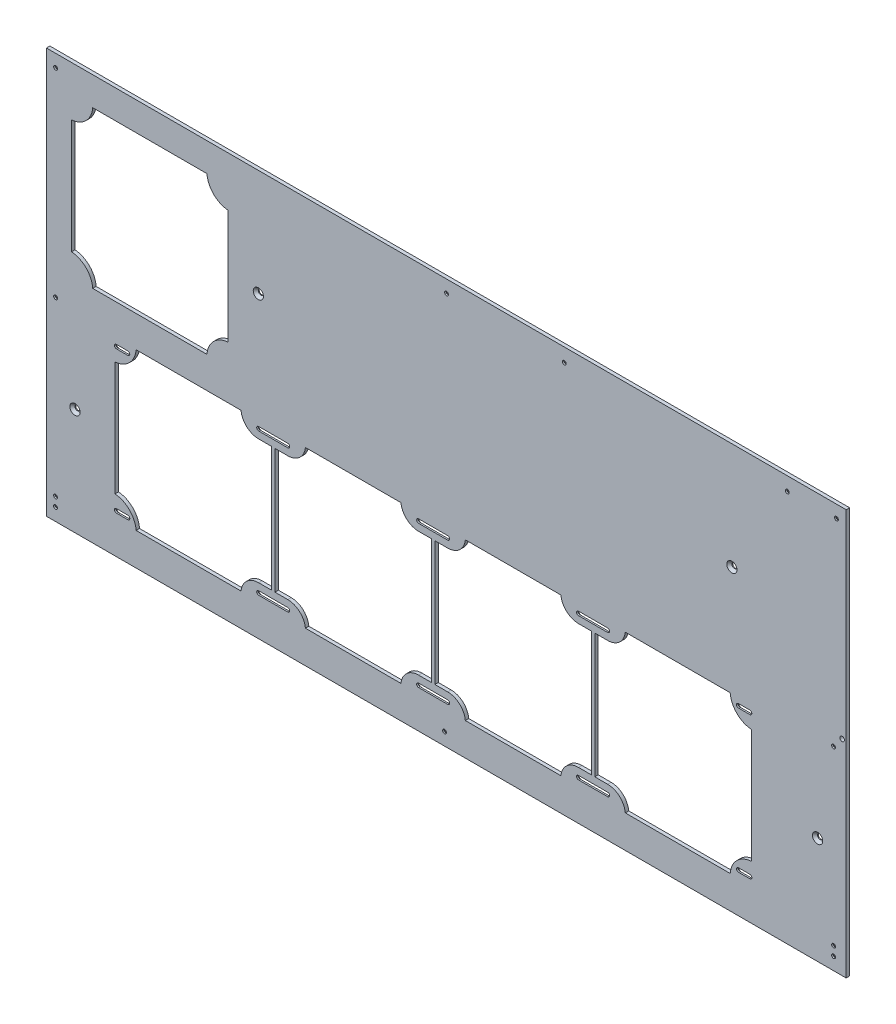
from build123d import *

# Parameters (mm, degrees)
SKETCH1_R                     = 2
BASE_FLANGE1_DEPTH            = 3
CSK_FOR_M4_SFHCS1_AT_2_COUNT  = 2
CSK_FOR_M4_SFHCS1_AT_2_PITCH  = 232.345109697
CSK_FOR_M4_SFHCS1_AT_3_COUNT  = 2
CSK_FOR_M4_SFHCS1_AT_3_PITCH  = 414.5
CSK_FOR_M4_SFHCS1_AT_4_COUNT  = 2
CSK_FOR_M4_SFHCS1_AT_4_PITCH  = 517.527052433
CSK_FOR_M3_SFHCS1_AT_2_COUNT  = 2
CSK_FOR_M3_SFHCS1_AT_2_PITCH  = 43.010492906
CSK_FOR_M3_SFHCS1_AT_3_COUNT  = 2
CSK_FOR_M3_SFHCS1_AT_3_PITCH  = 325.009615242
CSK_FOR_M3_SFHCS1_AT_4_COUNT  = 2
CSK_FOR_M3_SFHCS1_AT_4_PITCH  = 333.009384252
CSK_FOR_M3_SFHCS1_AT_5_COUNT  = 2
CSK_FOR_M3_SFHCS1_AT_5_PITCH  = 478.056482019
CSK_FOR_M3_SFHCS1_AT_6_COUNT  = 2
CSK_FOR_M3_SFHCS1_AT_6_PITCH  = 760.30339339
CSK_FOR_M3_SFHCS1_AT_7_COUNT  = 2
CSK_FOR_M3_SFHCS1_AT_7_PITCH  = 756.83370036
CSK_FOR_M3_SFHCS1_AT_8_COUNT  = 2
CSK_FOR_M3_SFHCS1_AT_8_PITCH  = 705.300113427
CSK_FOR_M3_SFHCS1_AT_9_COUNT  = 2
CSK_FOR_M3_SFHCS1_AT_9_PITCH  = 683.5
CSK_FOR_M3_SFHCS1_AT_10_COUNT = 2
CSK_FOR_M3_SFHCS1_AT_10_PITCH = 341.25
CSK_FOR_M3_SFHCS1_AT_11_COUNT = 2
CSK_FOR_M3_SFHCS1_AT_11_PITCH = 238.201894409
CSK_FOR_M3_SFHCS1_AT_12_COUNT = 2
CSK_FOR_M3_SFHCS1_AT_12_PITCH = 174.017958843
CUT_EXTRUDE1_DEPTH            = 784.07726311
CHAMFER1_SIZE                 = 1.66


# Read off the part's stored shape, not the designer's step: bottom.step
# Sheet-metal steps are written as plain solids
with BuildPart() as part:
    # Base-Flange1: sheet metal written as solids
    # Sketch1 → Base-Flange1 (new body)
    with BuildSketch(Plane.XY):
        Polygon((0, 351), (0, 347), (0, 0), (0, -4), (700, -4), (700, 0), (700, 347), (700, 351), align=None)
        with Locations((696.5, 175.5)):
            Circle(SKETCH1_R, mode=Mode.SUBTRACT)
        with BuildLine():
            Line((548.5, 24.5), (598.5, 24.5))
            ThreePointArc((598.5, 24.5), (604.318145396, 37.181854604), (617, 43))
            Line((617, 43), (617, 143))
            ThreePointArc((617, 143), (604.318145396, 148.818145396), (598.5, 161.5))
            Line((598.5, 161.5), (548.5, 161.5))
            Line((548.5, 161.5), (506.67724862, 161.5))
            ThreePointArc((506.67724862, 161.5), (501.666333328, 151.521759717), (491.25, 147.5))
            Line((491.25, 147.5), (480, 147.5))
            Line((480, 147.5), (480, 93))
            Line((480, 93), (480, 38.5))
            Line((480, 38.5), (491.25, 38.5))
            ThreePointArc((491.25, 38.5), (501.666333328, 34.478240283), (506.67724862, 24.5))
            Line((506.67724862, 24.5), (548.5, 24.5))
        make_face(mode=Mode.SUBTRACT)
        with BuildLine():
            Line((477, 147.5), (465.75, 147.5))
            ThreePointArc((465.75, 147.5), (455.333666672, 151.521759717), (450.32275138, 161.5))
            Line((450.32275138, 161.5), (408.5, 161.5))
            Line((408.5, 161.5), (366.67724862, 161.5))
            ThreePointArc((366.67724862, 161.5), (361.666333328, 151.521759717), (351.25, 147.5))
            Line((351.25, 147.5), (340, 147.5))
            Line((340, 147.5), (340, 93))
            Line((340, 93), (340, 38.5))
            Line((340, 38.5), (351.25, 38.5))
            ThreePointArc((351.25, 38.5), (361.666333328, 34.478240283), (366.67724862, 24.5))
            Line((366.67724862, 24.5), (408.5, 24.5))
            Line((408.5, 24.5), (450.32275138, 24.5))
            ThreePointArc((450.32275138, 24.5), (455.333666672, 34.478240283), (465.75, 38.5))
            Line((465.75, 38.5), (477, 38.5))
            Line((477, 38.5), (477, 93))
            Line((477, 93), (477, 147.5))
        make_face(mode=Mode.SUBTRACT)
        with BuildLine():
            Line((337, 147.5), (325.75, 147.5))
            ThreePointArc((325.75, 147.5), (315.333666672, 151.521759717), (310.32275138, 161.5))
            Line((310.32275138, 161.5), (268.5, 161.5))
            Line((268.5, 161.5), (226.67724862, 161.5))
            ThreePointArc((226.67724862, 161.5), (221.666333328, 151.521759717), (211.25, 147.5))
            Line((211.25, 147.5), (200, 147.5))
            Line((200, 147.5), (200, 93))
            Line((200, 93), (200, 38.5))
            Line((200, 38.5), (211.25, 38.5))
            ThreePointArc((211.25, 38.5), (221.666333328, 34.478240283), (226.677248621, 24.5))
            Line((226.677248621, 24.5), (268.5, 24.5))
            Line((268.5, 24.5), (310.32275138, 24.5))
            ThreePointArc((310.32275138, 24.5), (315.333666672, 34.478240283), (325.75, 38.5))
            Line((325.75, 38.5), (337, 38.5))
            Line((337, 38.5), (337, 93))
            Line((337, 93), (337, 147.5))
        make_face(mode=Mode.SUBTRACT)
        with BuildLine():
            Line((197, 147.5), (185.75, 147.5))
            ThreePointArc((185.75, 147.5), (175.333666672, 151.521759717), (170.322751379, 161.5))
            Line((170.322751379, 161.5), (128.5, 161.5))
            Line((128.5, 161.5), (78.5, 161.5))
            ThreePointArc((78.5, 161.5), (72.681854604, 148.818145396), (60, 143))
            Line((60, 143), (60, 43))
            ThreePointArc((60, 43), (72.681854604, 37.181854604), (78.5, 24.5))
            Line((78.5, 24.5), (128.5, 24.5))
            Line((128.5, 24.5), (170.32275138, 24.5))
            ThreePointArc((170.32275138, 24.5), (175.333666672, 34.478240283), (185.75, 38.5))
            Line((185.75, 38.5), (197, 38.5))
            Line((197, 38.5), (197, 93))
            Line((197, 93), (197, 147.5))
        make_face(mode=Mode.SUBTRACT)
        with BuildLine():
            Line((90.5, 326), (40.5, 326))
            ThreePointArc((40.5, 326), (34.681854604, 313.318145396), (22, 307.5))
            Line((22, 307.5), (22, 257.5))
            Line((22, 257.5), (22, 207.5))
            ThreePointArc((22, 207.5), (34.681854604, 201.681854604), (40.5, 189))
            Line((40.5, 189), (90.5, 189))
            Line((90.5, 189), (140.5, 189))
            ThreePointArc((140.5, 189), (146.318145396, 201.681854604), (159, 207.5))
            Line((159, 207.5), (159, 257.5))
            Line((159, 257.5), (159, 307.5))
            ThreePointArc((159, 307.5), (146.318145396, 313.318145396), (140.5, 326))
            Line((140.5, 326), (90.5, 326))
        make_face(mode=Mode.SUBTRACT)
    extrude(amount=-BASE_FLANGE1_DEPTH)

    # Sketch3 → CSK for M4 SFHCS1 (revolve, cut)
    with BuildSketch(Plane(origin=(185.5, 257.5, 0), x_dir=(0, -1, 0), z_dir=(1, 0, 0))):
        Polygon((0, 0), (0, 3), (2.25, 3), (2.25, 2.23), (4.48, 0), align=None)
    csk_for_m4_sfhcs1 = revolve(axis=Axis((185.5, 257.5, 6.35), (0, 0, -1)), mode=Mode.SUBTRACT)

    # CSK for M4 SFHCS1 at 2: CSK for M4 SFHCS1 ×2
    with Locations(*[Vector(-0.690782776575208, -0.7230623455740495, 0) * (i * CSK_FOR_M4_SFHCS1_AT_2_PITCH) for i in range(1, CSK_FOR_M4_SFHCS1_AT_2_COUNT)]):
        add(csk_for_m4_sfhcs1, mode=Mode.SUBTRACT)

    # CSK for M4 SFHCS1 at 3: CSK for M4 SFHCS1 ×2
    with Locations(*[(i * CSK_FOR_M4_SFHCS1_AT_3_PITCH, 0, 0) for i in range(1, CSK_FOR_M4_SFHCS1_AT_3_COUNT)]):
        add(csk_for_m4_sfhcs1, mode=Mode.SUBTRACT)

    # CSK for M4 SFHCS1 at 4: CSK for M4 SFHCS1 ×2
    with Locations(*[Vector(0.9458442755769982, -0.3246207115361302, 0) * (i * CSK_FOR_M4_SFHCS1_AT_4_PITCH) for i in range(1, CSK_FOR_M4_SFHCS1_AT_4_COUNT)]):
        add(csk_for_m4_sfhcs1, mode=Mode.SUBTRACT)

    # Sketch5 → CSK for M3 SFHCS1 (revolve, cut)
    with BuildSketch(Plane(origin=(691.5, 340, -3), x_dir=(0, 1, 0), z_dir=(1, 0, 0))):
        Polygon((0, 0), (0, 3), (1.7, 3), (1.7, 1.66), (3.36, 0), align=None)
    csk_for_m3_sfhcs1 = revolve(axis=Axis((691.5, 340, -9.35), (0, 0, 1)), mode=Mode.SUBTRACT)

    # CSK for M3 SFHCS1 at 2: CSK for M3 SFHCS1 ×2
    with Locations(*[Vector(-0.9997560384666023, -0.0220876334079881, 0) * (i * CSK_FOR_M3_SFHCS1_AT_2_PITCH) for i in range(1, CSK_FOR_M3_SFHCS1_AT_2_COUNT)]):
        add(csk_for_m3_sfhcs1, mode=Mode.SUBTRACT)

    # CSK for M3 SFHCS1 at 3: CSK for M3 SFHCS1 ×2
    with Locations(*[Vector(-0.00769208011933921, -0.9999704155140979, 0) * (i * CSK_FOR_M3_SFHCS1_AT_3_PITCH) for i in range(1, CSK_FOR_M3_SFHCS1_AT_3_COUNT)]):
        add(csk_for_m3_sfhcs1, mode=Mode.SUBTRACT)

    # CSK for M3 SFHCS1 at 4: CSK for M3 SFHCS1 ×2
    with Locations(*[Vector(-0.0075072959448704, -0.9999718198567379, 0) * (i * CSK_FOR_M3_SFHCS1_AT_4_PITCH) for i in range(1, CSK_FOR_M3_SFHCS1_AT_4_COUNT)]):
        add(csk_for_m3_sfhcs1, mode=Mode.SUBTRACT)

    # CSK for M3 SFHCS1 at 5: CSK for M3 SFHCS1 ×2
    with Locations(*[Vector(-0.7174884410136596, -0.6965704106634076, 0) * (i * CSK_FOR_M3_SFHCS1_AT_5_PITCH) for i in range(1, CSK_FOR_M3_SFHCS1_AT_5_COUNT)]):
        add(csk_for_m3_sfhcs1, mode=Mode.SUBTRACT)

    # CSK for M3 SFHCS1 at 6: CSK for M3 SFHCS1 ×2
    with Locations(*[Vector(-0.8989832295140143, -0.437983051101927, 0) * (i * CSK_FOR_M3_SFHCS1_AT_6_PITCH) for i in range(1, CSK_FOR_M3_SFHCS1_AT_6_COUNT)]):
        add(csk_for_m3_sfhcs1, mode=Mode.SUBTRACT)

    # CSK for M3 SFHCS1 at 7: CSK for M3 SFHCS1 ×2
    with Locations(*[Vector(-0.9031046049815783, -0.42942062416827104, 0) * (i * CSK_FOR_M3_SFHCS1_AT_7_PITCH) for i in range(1, CSK_FOR_M3_SFHCS1_AT_7_COUNT)]):
        add(csk_for_m3_sfhcs1, mode=Mode.SUBTRACT)

    # CSK for M3 SFHCS1 at 8: CSK for M3 SFHCS1 ×2
    with Locations(*[Vector(-0.9690910110293626, -0.2467034907375412, 0) * (i * CSK_FOR_M3_SFHCS1_AT_8_PITCH) for i in range(1, CSK_FOR_M3_SFHCS1_AT_8_COUNT)]):
        add(csk_for_m3_sfhcs1, mode=Mode.SUBTRACT)

    # CSK for M3 SFHCS1 at 9: CSK for M3 SFHCS1 ×2
    with Locations(*[(-i * CSK_FOR_M3_SFHCS1_AT_9_PITCH, 0, 0) for i in range(1, CSK_FOR_M3_SFHCS1_AT_9_COUNT)]):
        add(csk_for_m3_sfhcs1, mode=Mode.SUBTRACT)

    # CSK for M3 SFHCS1 at 10: CSK for M3 SFHCS1 ×2
    with Locations(*[(-i * CSK_FOR_M3_SFHCS1_AT_10_PITCH, 0, 0) for i in range(1, CSK_FOR_M3_SFHCS1_AT_10_COUNT)]):
        add(csk_for_m3_sfhcs1, mode=Mode.SUBTRACT)

    # CSK for M3 SFHCS1 at 11: CSK for M3 SFHCS1 ×2
    with Locations(*[Vector(-0.9999920470450988, -0.003988213453791425, 0) * (i * CSK_FOR_M3_SFHCS1_AT_11_PITCH) for i in range(1, CSK_FOR_M3_SFHCS1_AT_11_COUNT)]):
        add(csk_for_m3_sfhcs1, mode=Mode.SUBTRACT)

    # CSK for M3 SFHCS1 at 12: CSK for M3 SFHCS1 ×2
    with Locations(*[Vector(-0.014366333317647544, -0.9998967989082705, 0) * (i * CSK_FOR_M3_SFHCS1_AT_12_PITCH) for i in range(1, CSK_FOR_M3_SFHCS1_AT_12_COUNT)]):
        add(csk_for_m3_sfhcs1, mode=Mode.SUBTRACT)

    # Sketch6 → Cut-Extrude1 (cut, through all)
    with BuildSketch(Plane.XY):
        with BuildLine():
            Line((61.25, 156.95), (71.25, 156.95))
            ThreePointArc((71.25, 156.95), (72.95, 155.25), (71.25, 153.55))
            Line((71.25, 153.55), (61.25, 153.55))
            ThreePointArc((61.25, 153.55), (59.55, 155.25), (61.25, 156.95))
        make_face()
        with BuildLine():
            Line((185.75, 156.95), (211.25, 156.95))
            ThreePointArc((211.25, 156.95), (212.95, 155.25), (211.25, 153.55))
            Line((211.25, 153.55), (185.75, 153.55))
            ThreePointArc((185.75, 153.55), (184.05, 155.25), (185.75, 156.95))
        make_face()
        with BuildLine():
            Line((61.25, 32.45), (71.25, 32.45))
            ThreePointArc((71.25, 32.45), (72.95, 30.75), (71.25, 29.05))
            Line((71.25, 29.05), (61.25, 29.05))
            ThreePointArc((61.25, 29.05), (59.55, 30.75), (61.25, 32.45))
        make_face()
        with BuildLine():
            Line((185.75, 32.45), (211.25, 32.45))
            ThreePointArc((211.25, 32.45), (212.95, 30.75), (211.25, 29.05))
            Line((211.25, 29.05), (185.75, 29.05))
            ThreePointArc((185.75, 29.05), (184.05, 30.75), (185.75, 32.45))
        make_face()
        with BuildLine():
            Line((325.75, 156.95), (351.25, 156.95))
            ThreePointArc((351.25, 156.95), (352.95, 155.25), (351.25, 153.55))
            Line((351.25, 153.55), (325.75, 153.55))
            ThreePointArc((325.75, 153.55), (324.05, 155.25), (325.75, 156.95))
        make_face()
        with BuildLine():
            Line((325.75, 32.45), (351.25, 32.45))
            ThreePointArc((351.25, 32.45), (352.95, 30.75), (351.25, 29.05))
            Line((351.25, 29.05), (325.75, 29.05))
            ThreePointArc((325.75, 29.05), (324.05, 30.75), (325.75, 32.45))
        make_face()
        with BuildLine():
            Line((465.75, 156.95), (491.25, 156.95))
            ThreePointArc((491.25, 156.95), (492.95, 155.25), (491.25, 153.55))
            Line((491.25, 153.55), (465.75, 153.55))
            ThreePointArc((465.75, 153.55), (464.05, 155.25), (465.75, 156.95))
        make_face()
        with BuildLine():
            Line((605.75, 156.95), (615.75, 156.95))
            ThreePointArc((615.75, 156.95), (617.45, 155.25), (615.75, 153.55))
            Line((615.75, 153.55), (605.75, 153.55))
            ThreePointArc((605.75, 153.55), (604.05, 155.25), (605.75, 156.95))
        make_face()
        with BuildLine():
            Line((605.75, 32.45), (615.75, 32.45))
            ThreePointArc((615.75, 32.45), (617.45, 30.75), (615.75, 29.05))
            Line((615.75, 29.05), (605.75, 29.05))
            ThreePointArc((605.75, 29.05), (604.05, 30.75), (605.75, 32.45))
        make_face()
        with BuildLine():
            Line((465.75, 32.45), (491.25, 32.45))
            ThreePointArc((491.25, 32.45), (492.95, 30.75), (491.25, 29.05))
            Line((491.25, 29.05), (465.75, 29.05))
            ThreePointArc((465.75, 29.05), (464.05, 30.75), (465.75, 32.45))
        make_face()
    extrude(amount=-CUT_EXTRUDE1_DEPTH, mode=Mode.SUBTRACT)

    # Chamfer1
    chamfer1_edges = [part.edges().sort_by_distance(p)[0] for p in [
        (604.05, 30.75, -3),
        (610.75, 32.45, -3),
        (617.45, 30.75, -3),
        (610.75, 29.05, -3),
        (604.05, 155.25, -3),
        (610.75, 156.95, -3),
        (617.45, 155.25, -3),
        (610.75, 153.55, -3),
        (464.05, 155.25, -3),
        (478.5, 156.95, -3),
        (492.95, 155.25, -3),
        (478.5, 153.55, -3),
        (324.05, 30.75, -3),
        (338.5, 32.45, -3),
        (352.95, 30.75, -3),
        (338.5, 29.05, -3),
        (184.05, 155.25, -3),
        (198.5, 156.95, -3),
        (212.95, 155.25, -3),
        (198.5, 153.55, -3),
        (59.55, 30.75, -3),
        (66.25, 32.45, -3),
        (72.95, 30.75, -3),
        (66.25, 29.05, -3),
        (184.05, 30.75, -3),
        (198.5, 32.45, -3),
        (212.95, 30.75, -3),
        (198.5, 29.05, -3),
        (324.05, 155.25, -3),
        (338.5, 156.95, -3),
        (352.95, 155.25, -3),
        (338.5, 153.55, -3),
        (464.05, 30.75, -3),
        (478.5, 32.45, -3),
        (492.95, 30.75, -3),
        (478.5, 29.05, -3),
        (59.55, 155.25, -3),
        (66.25, 156.95, -3),
        (72.95, 155.25, -3),
        (66.25, 153.55, -3),
    ]]
    chamfer(chamfer1_edges, length=CHAMFER1_SIZE)


solid = part.part
